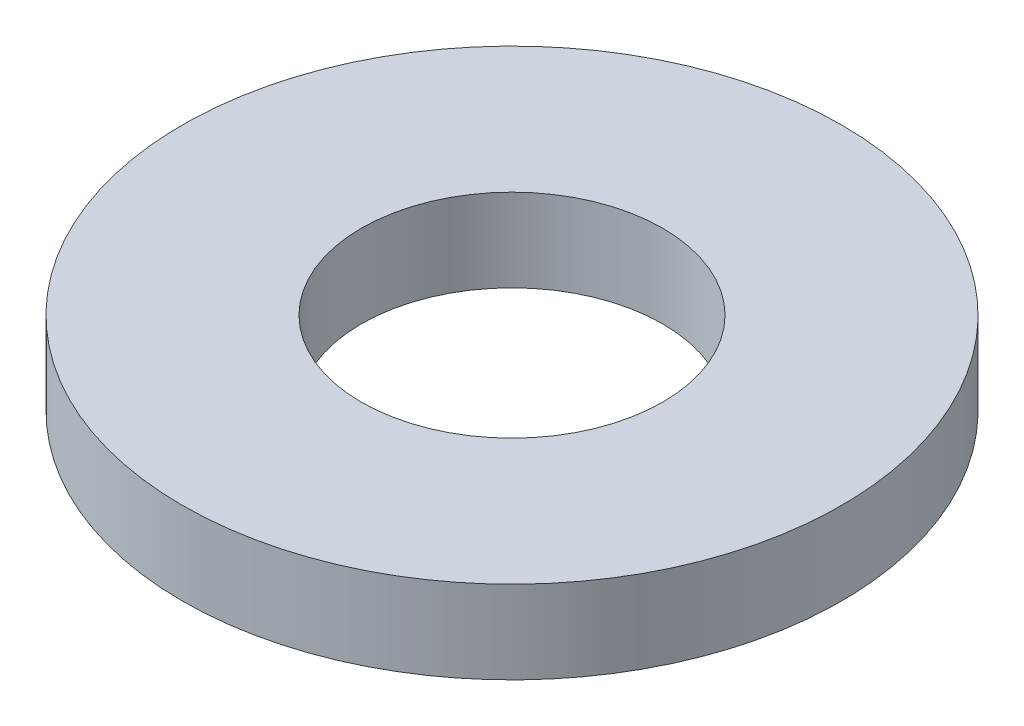
from build123d import *

# Parameters (mm, degrees)
SKETCH1_R           = 87.5
BOSS_EXTRUDE1_DEPTH = 22
SKETCH2_R           = 40
CUT_EXTRUDE1_DEPTH  = 126.684127876


with BuildPart() as part:
    # Sketch1 → Boss-Extrude1 (new body)
    with BuildSketch(Plane(origin=(0, 0, 0), x_dir=(1, 0, 0), z_dir=(0, 1, 0))):
        Circle(SKETCH1_R)
    extrude(amount=BOSS_EXTRUDE1_DEPTH)

    # Sketch2 → Cut-Extrude1 (cut, through all)
    with BuildSketch(Plane(origin=(0, 0, 0), x_dir=(1, 0, 0), z_dir=(0, 1, 0))):
        Circle(SKETCH2_R)
    extrude(amount=CUT_EXTRUDE1_DEPTH, mode=Mode.SUBTRACT)


solid = part.part
